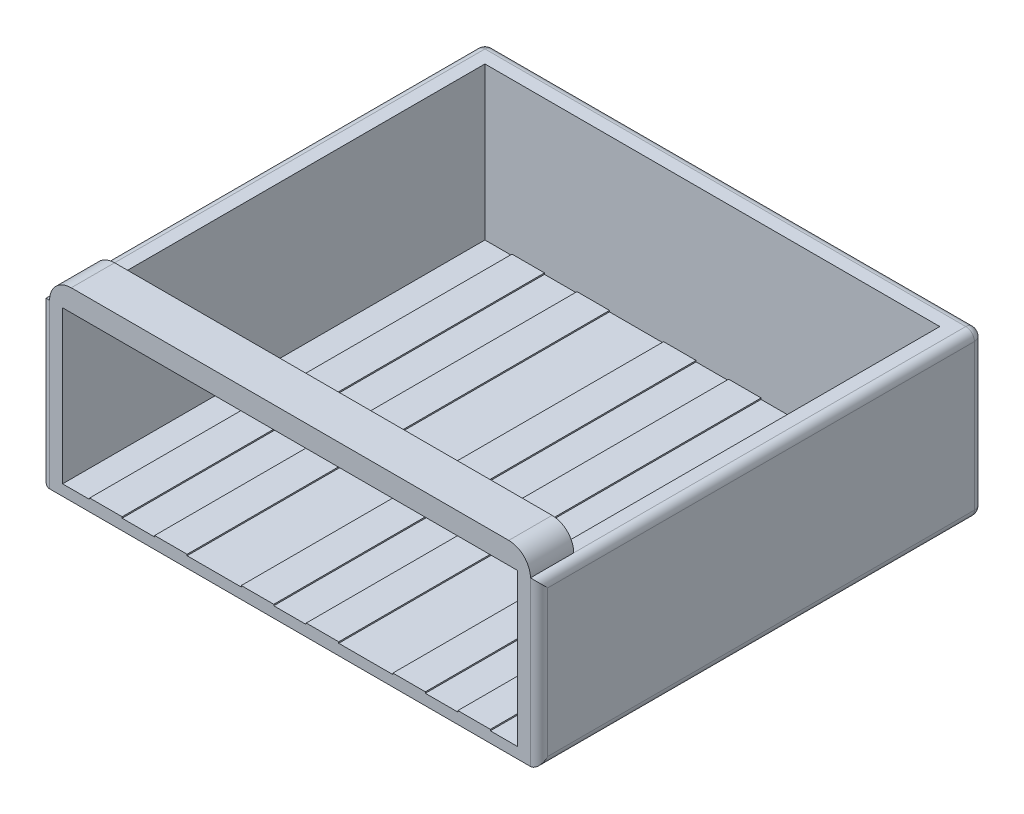
from build123d import *

# Parameters (mm, degrees)
SKETCH1_W           = 266.7
SKETCH1_H           = 247.65
BOSS_EXTRUDE1_DEPTH = 6.35
SKETCH2_W           = 247.65
SKETCH2_H           = 95.758
BOSS_EXTRUDE2_DEPTH = 12.7
SKETCH3_W           = 292.1
SKETCH3_H           = 95.758
BOSS_EXTRUDE3_DEPTH = 12.7
SKETCH4_W           = 19.05
SKETCH4_H           = 247.65
BOSS_EXTRUDE4_DEPTH = 0.762
FILLET1_R           = 5.08
SKETCH6_W           = 281.94
SKETCH6_H           = 12.7
BOSS_EXTRUDE5_DEPTH = 25.4
FILLET2_R           = 12.7


with BuildPart() as part:
    # Sketch1 → Boss-Extrude1 (new body)
    with BuildSketch(Plane(origin=(0, 0, 0), x_dir=(1, 0, 0), z_dir=(0, 1, 0))):
        Rectangle(SKETCH1_W, SKETCH1_H)
    extrude(amount=BOSS_EXTRUDE1_DEPTH)

    # Sketch2 → Boss-Extrude2 (add)
    with BuildSketch(Plane.ZY.offset(133.35)):
        with Locations((0, 47.879)):
            Rectangle(SKETCH2_W, SKETCH2_H)
    boss_extrude2 = extrude(amount=BOSS_EXTRUDE2_DEPTH)

    # Mirror1: Boss-Extrude2 across plane
    add(boss_extrude2.mirror(Plane(origin=(0, 0, 0), x_dir=(0, 0, 1), z_dir=(1, 0, 0))))

    # Sketch3 → Boss-Extrude3 (add)
    with BuildSketch(Plane(origin=(0, 0, -123.825), x_dir=(-1, 0, 0), z_dir=(0, 0, -1))):
        with Locations((0, 47.879)):
            Rectangle(SKETCH3_W, SKETCH3_H)
    extrude(amount=BOSS_EXTRUDE3_DEPTH)

    # Sketch4 → Boss-Extrude4 (add)
    with BuildSketch(Plane(origin=(0, 6.35, 0), x_dir=(1, 0, 0), z_dir=(0, 1, 0))):
        with Locations((-107.95, 0)):
            Rectangle(SKETCH4_W, SKETCH4_H)
        with Locations((-69.85, 0)):
            Rectangle(SKETCH4_W, SKETCH4_H)
        with Locations((-19.05, 0)):
            Rectangle(SKETCH4_W, SKETCH4_H)
        with Locations((19.05, 0)):
            Rectangle(SKETCH4_W, SKETCH4_H)
        with Locations((69.85, 0)):
            Rectangle(SKETCH4_W, SKETCH4_H)
        with Locations((107.95, 0)):
            Rectangle(SKETCH4_W, SKETCH4_H)
    extrude(amount=BOSS_EXTRUDE4_DEPTH)

    # Fillet1
    fillet1_edges = [part.edges().sort_by_distance(p)[0] for p in [
        (-146.05, 0, -6.35),
        (-146.05, 47.879, 123.825),
        (-146.05, 95.758, -6.35),
        (146.05, 0, -6.35),
        (146.05, 95.758, -6.35),
        (146.05, 47.879, 123.825),
        (0, 0, -136.525),
        (-146.05, 47.879, -136.525),
        (0, 95.758, -136.525),
        (146.05, 47.879, -136.525),
    ]]
    fillet(fillet1_edges, radius=FILLET1_R)

    # Sketch6 → Boss-Extrude5 (add)
    with BuildSketch(Plane.XY.offset(123.825)):
        with Locations((0, 102.108)):
            Rectangle(SKETCH6_W, SKETCH6_H)
    extrude(amount=-BOSS_EXTRUDE5_DEPTH)

    # Fillet2
    fillet2_edges = [part.edges().sort_by_distance(p)[0] for p in [
        (140.97, 108.458, 111.125),
        (-140.97, 108.458, 111.125),
    ]]
    fillet(fillet2_edges, radius=FILLET2_R - 0.0001)  # a hair under: the kernel refuses the full size


solid = part.part
